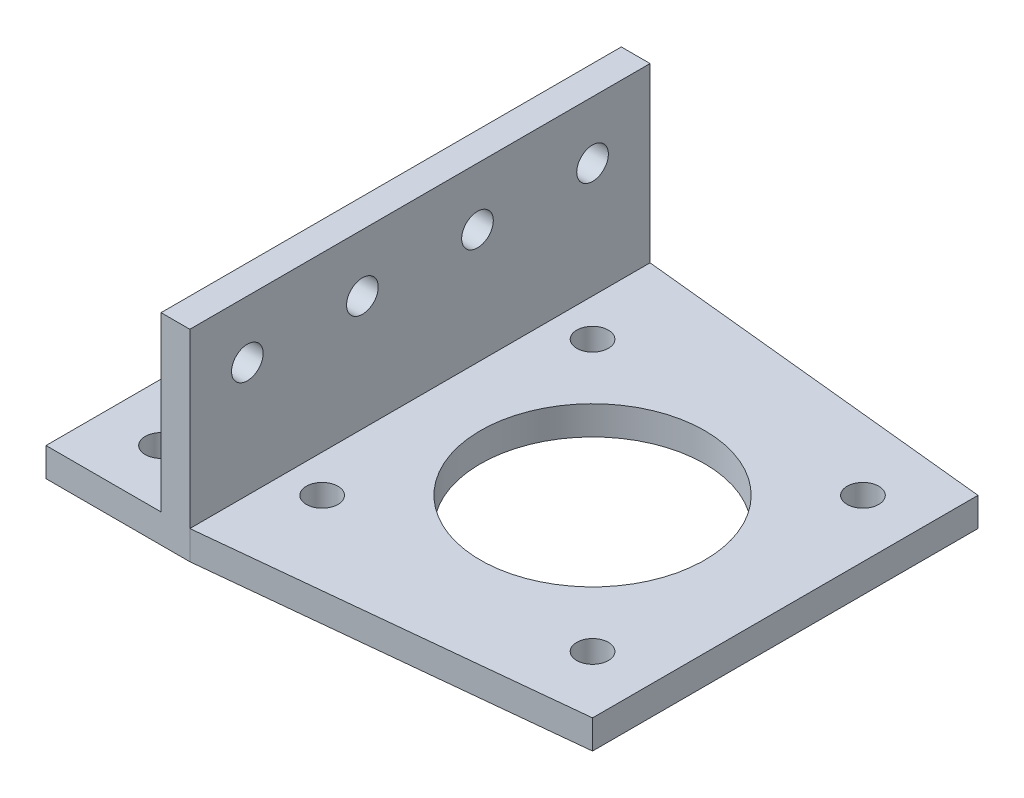
from build123d import *

# Parameters (mm, degrees)
BOSS_EXTRU_1_DEPTH      = 80
ENL_V_MAT_EXTRU_1_REACH = 91.582
ESQUISSE2_R             = 2.75
ENL_V_MAT_EXTRU_2_REACH = 92.436
ESQUISSE3_R             = 2.75
ESQUISSE5_R             = 2.75
ESQUISSE5_R_2           = 19.5
BOSS_EXTRU_2_DEPTH      = 5


with BuildPart() as part:
    # Esquisse1 → Boss.-Extru.1 (new body)
    with BuildSketch(Plane.XY):
        Polygon((-4.641855204, 0), (-4.641855204, 35), (-9.641855204, 35), (-9.641855204, 5), (-29.641855204, 5), (-29.641855204, 0), align=None)
    extrude(amount=BOSS_EXTRU_1_DEPTH)

    # Esquisse2 → Enlèv. mat.-Extru.1 (cut, up to next)
    with BuildSketch(Plane.ZY.offset(9.641855204), mode=Mode.PRIVATE) as enl_v_mat_extru_1_sk1:
        with Locations((10, 25)):
            Circle(ESQUISSE2_R)
    enl_v_mat_extru_1_tool1 = extrude(enl_v_mat_extru_1_sk1.sketch, amount=-ENL_V_MAT_EXTRU_1_REACH, mode=Mode.PRIVATE) & part.part
    # Esquisse2 → Enlèv. mat.-Extru.1 (cut, up to next)
    with BuildSketch(Plane.ZY.offset(9.641855204), mode=Mode.PRIVATE) as enl_v_mat_extru_1_sk2:
        with Locations((50, 25)):
            Circle(ESQUISSE2_R)
    enl_v_mat_extru_1_tool2 = extrude(enl_v_mat_extru_1_sk2.sketch, amount=-ENL_V_MAT_EXTRU_1_REACH, mode=Mode.PRIVATE) & part.part
    # Esquisse2 → Enlèv. mat.-Extru.1 (cut, up to next)
    with BuildSketch(Plane.ZY.offset(9.641855204), mode=Mode.PRIVATE) as enl_v_mat_extru_1_sk3:
        with Locations((70, 25)):
            Circle(ESQUISSE2_R)
    enl_v_mat_extru_1_tool3 = extrude(enl_v_mat_extru_1_sk3.sketch, amount=-ENL_V_MAT_EXTRU_1_REACH, mode=Mode.PRIVATE) & part.part
    # Esquisse2 → Enlèv. mat.-Extru.1 (cut, up to next)
    with BuildSketch(Plane.ZY.offset(9.641855204), mode=Mode.PRIVATE) as enl_v_mat_extru_1_sk4:
        with Locations((30, 25)):
            Circle(ESQUISSE2_R)
    enl_v_mat_extru_1_tool4 = extrude(enl_v_mat_extru_1_sk4.sketch, amount=-ENL_V_MAT_EXTRU_1_REACH, mode=Mode.PRIVATE) & part.part
    add(enl_v_mat_extru_1_tool1.solids().sort_by_distance((-9.641855, 25, 10))[0], mode=Mode.SUBTRACT)
    add(enl_v_mat_extru_1_tool2.solids().sort_by_distance((-9.641855, 25, 50))[0], mode=Mode.SUBTRACT)
    add(enl_v_mat_extru_1_tool3.solids().sort_by_distance((-9.641855, 25, 70))[0], mode=Mode.SUBTRACT)
    add(enl_v_mat_extru_1_tool4.solids().sort_by_distance((-9.641855, 25, 30))[0], mode=Mode.SUBTRACT)

    # Esquisse3 → Enlèv. mat.-Extru.2 (cut, up to next)
    with BuildSketch(Plane(origin=(0, 5, 0), x_dir=(1, 0, 0), z_dir=(0, 1, 0)), mode=Mode.PRIVATE) as enl_v_mat_extru_2_sk1:
        with Locations((-19.641855204, -10)):
            Circle(ESQUISSE3_R)
    enl_v_mat_extru_2_tool1 = extrude(enl_v_mat_extru_2_sk1.sketch, amount=-ENL_V_MAT_EXTRU_2_REACH, mode=Mode.PRIVATE) & part.part
    # Esquisse3 → Enlèv. mat.-Extru.2 (cut, up to next)
    with BuildSketch(Plane(origin=(0, 5, 0), x_dir=(1, 0, 0), z_dir=(0, 1, 0)), mode=Mode.PRIVATE) as enl_v_mat_extru_2_sk2:
        with Locations((-19.641855204, -30)):
            Circle(ESQUISSE3_R)
    enl_v_mat_extru_2_tool2 = extrude(enl_v_mat_extru_2_sk2.sketch, amount=-ENL_V_MAT_EXTRU_2_REACH, mode=Mode.PRIVATE) & part.part
    # Esquisse3 → Enlèv. mat.-Extru.2 (cut, up to next)
    with BuildSketch(Plane(origin=(0, 5, 0), x_dir=(1, 0, 0), z_dir=(0, 1, 0)), mode=Mode.PRIVATE) as enl_v_mat_extru_2_sk3:
        with Locations((-19.641855204, -50)):
            Circle(ESQUISSE3_R)
    enl_v_mat_extru_2_tool3 = extrude(enl_v_mat_extru_2_sk3.sketch, amount=-ENL_V_MAT_EXTRU_2_REACH, mode=Mode.PRIVATE) & part.part
    # Esquisse3 → Enlèv. mat.-Extru.2 (cut, up to next)
    with BuildSketch(Plane(origin=(0, 5, 0), x_dir=(1, 0, 0), z_dir=(0, 1, 0)), mode=Mode.PRIVATE) as enl_v_mat_extru_2_sk4:
        with Locations((-19.641855204, -70)):
            Circle(ESQUISSE3_R)
    enl_v_mat_extru_2_tool4 = extrude(enl_v_mat_extru_2_sk4.sketch, amount=-ENL_V_MAT_EXTRU_2_REACH, mode=Mode.PRIVATE) & part.part
    add(enl_v_mat_extru_2_tool1.solids().sort_by_distance((-19.641855, 5, 10))[0], mode=Mode.SUBTRACT)
    add(enl_v_mat_extru_2_tool2.solids().sort_by_distance((-19.641855, 5, 30))[0], mode=Mode.SUBTRACT)
    add(enl_v_mat_extru_2_tool3.solids().sort_by_distance((-19.641855, 5, 50))[0], mode=Mode.SUBTRACT)
    add(enl_v_mat_extru_2_tool4.solids().sort_by_distance((-19.641855, 5, 70))[0], mode=Mode.SUBTRACT)

    # Esquisse5 → Boss.-Extru.2 (add)
    with BuildSketch(Plane.XZ):
        Polygon((58.858144796, 6.5), (58.858144796, 73.5), (-4.641855204, 80), (-4.641855204, 0), align=None)
        with Locations((1.858144796, 16.5)):
            Circle(ESQUISSE5_R, mode=Mode.SUBTRACT)
        with Locations((48.858144796, 16.5)):
            Circle(ESQUISSE5_R, mode=Mode.SUBTRACT)
        with Locations((25.358144796, 40)):
            Circle(ESQUISSE5_R_2, mode=Mode.SUBTRACT)
        with Locations((1.858144796, 63.5)):
            Circle(ESQUISSE5_R, mode=Mode.SUBTRACT)
        with Locations((48.858144796, 63.5)):
            Circle(ESQUISSE5_R, mode=Mode.SUBTRACT)
    extrude(amount=-BOSS_EXTRU_2_DEPTH)


solid = part.part
